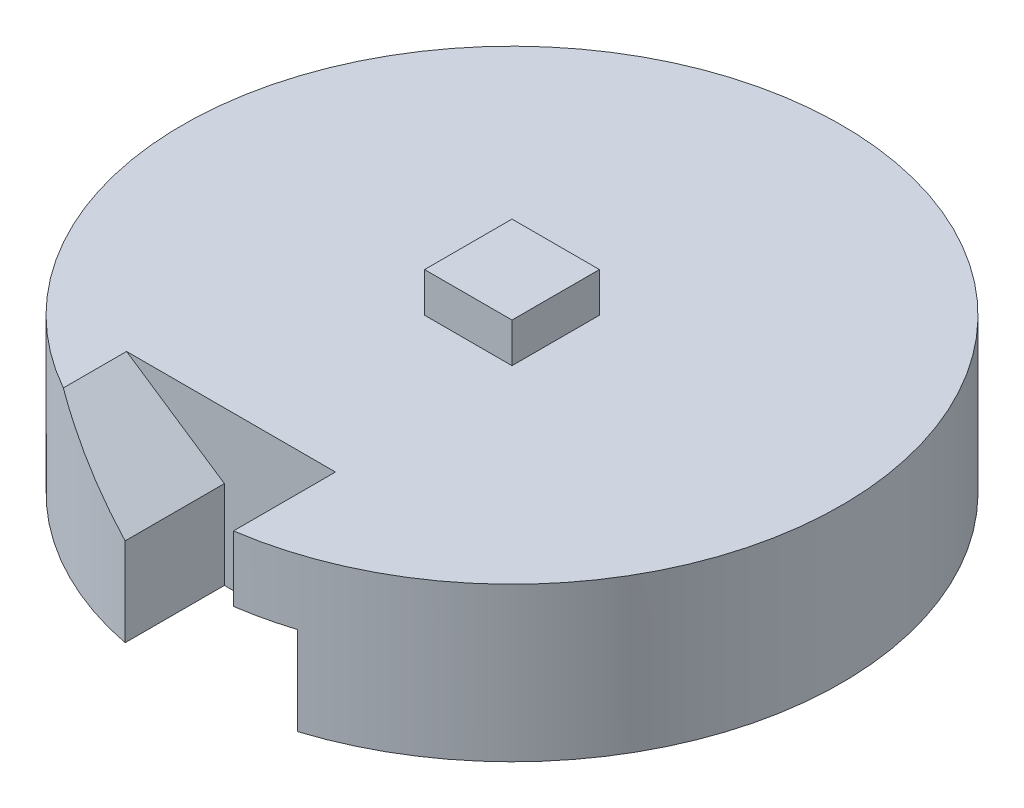
from build123d import *

# Parameters (mm, degrees)
SKETCH1_R           = 37.5
BOSS_EXTRUDE1_DEPTH = 17.5
CUT_EXTRUDE3_DEPTH  = 12
SKETCH9_W           = 9.95
SKETCH9_H           = 9.95
BOSS_EXTRUDE2_DEPTH = 22
SKETCH2_R           = 5
BOSS_EXTRUDE3_DEPTH = 10
CUT_EXTRUDE5_DEPTH  = 10
CUT_EXTRUDE6_DEPTH  = 1.6


with BuildPart() as part:
    # Sketch1 → Boss-Extrude1 (new body)
    with BuildSketch(Plane(origin=(0, 0, 0), x_dir=(1, 0, 0), z_dir=(0, 1, 0))):
        Circle(SKETCH1_R)
    extrude(amount=BOSS_EXTRUDE1_DEPTH)

    # Sketch7 → Cut-Extrude3 (cut)
    with BuildSketch(Plane.XY.offset(37.5)):
        Polygon((5.409167976, 17.669921883), (-18.615329351, 17.669921883), (-7.232029952, 10.040131917), (-7.232029952, -0.186148413), (11.337754855, -0.186148413), (11.337754855, 10.05869391), (5.409167976, 10.05869391), align=None)
    extrude(amount=-CUT_EXTRUDE3_DEPTH, mode=Mode.SUBTRACT)

    # Sketch9 → Boss-Extrude2 (add)
    with BuildSketch(Plane(origin=(0, 0, 0), x_dir=(1, 0, 0), z_dir=(0, 1, 0))):
        Rectangle(SKETCH9_W, SKETCH9_H)
    extrude(amount=BOSS_EXTRUDE2_DEPTH)

    # Sketch2 → Boss-Extrude3 (add)
    with BuildSketch(Plane.XZ):
        Circle(SKETCH2_R)
    extrude(amount=BOSS_EXTRUDE3_DEPTH)

    # Sketch11 → Cut-Extrude5 (cut)
    with BuildSketch(Plane.XZ.offset(10)):
        with BuildLine():
            Line((0.018011531, -1.443232403), (0.565734089, -1.443232403))
            ThreePointArc((0.565734089, -1.443232403), (0.018011531, 1.556767597), (-0.529711026, -1.443232403))
            Line((-0.529711026, -1.443232403), (0.018011531, -1.443232403))
        make_face()
    extrude(amount=-CUT_EXTRUDE5_DEPTH, mode=Mode.SUBTRACT)

    # Sketch12 → Cut-Extrude6 (cut)
    with BuildSketch(Plane(origin=(0, 0, 0), x_dir=(-1, 0, 0), z_dir=(0, -1, 0))):
        with BuildLine():
            Line((-31.522768768, -2.6309495), (-30.018011531, -5.228400909))
            Line((-30.018011531, -5.228400909), (-28.513254295, -2.6309495))
            ThreePointArc((-28.513254295, -2.6309495), (-30.018011531, 3.018232403), (-31.522768768, -2.6309495))
        make_face()
        with BuildLine():
            ThreePointArc((32.995326485, -0.272133378), (28.596593727, 2.682341253), (28.448805056, -2.614443502))
            Line((28.448805056, -2.614443502), (29.981988469, -5.228400909))
            Line((29.981988469, -5.228400909), (31.725749943, -2.47859302))
            ThreePointArc((31.725749943, -2.47859302), (32.53663496, -1.626769544), (32.961379359, -0.530079095))
            Line((32.961379359, -0.530079095), (33.124952896, -0.272133378))
            Line((33.124952896, -0.272133378), (32.995326485, -0.272133378))
        make_face()
    extrude(amount=-CUT_EXTRUDE6_DEPTH, mode=Mode.SUBTRACT)


solid = part.part
